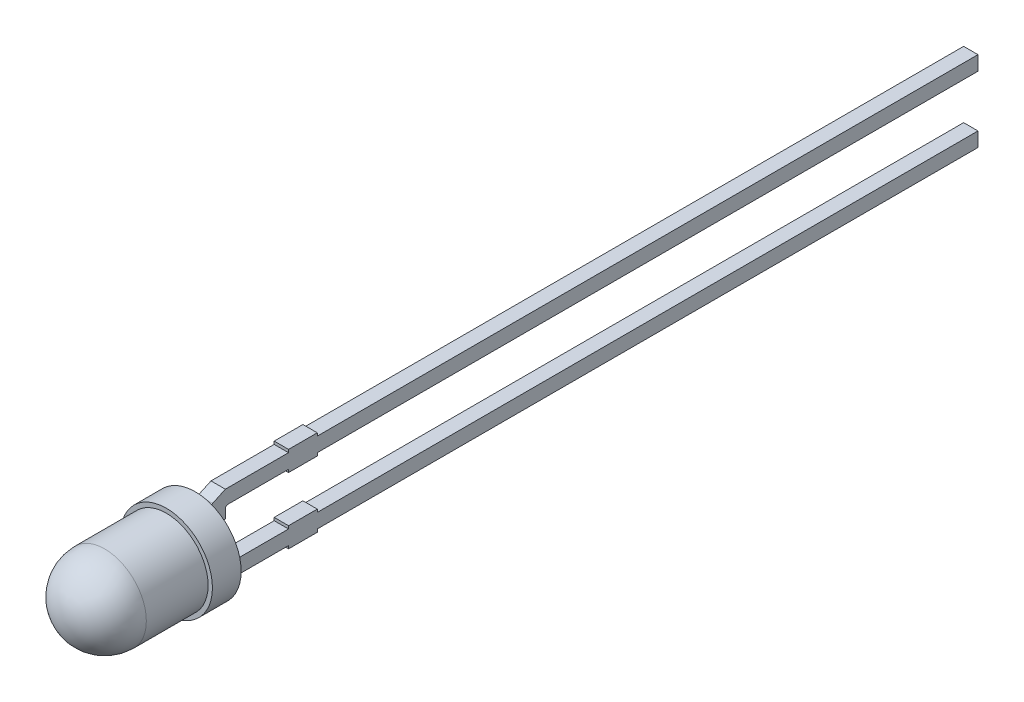
from build123d import *

# Parameters (mm, degrees)
EXTRUDE1_DEPTH = 0.25
FILLET1_R      = 0.25


with BuildPart() as part:
    # Sketch1 → Revolve1 (revolve)
    with BuildSketch(Plane(origin=(0, 0, 0), x_dir=(0, 0, -1), z_dir=(1, 0, 0))):
        with BuildLine():
            Line((0, 1.45), (2.15, 1.45))
            Line((2.15, 1.45), (2.15, 1.599999975))
            Line((2.15, 1.599999975), (3.15, 1.599999975))
            Line((3.15, 1.599999975), (3.15, 0))
            Line((3.15, 0), (-1.45, 0))
            ThreePointArc((-1.45, 0), (-1.025304833, 1.025304833), (0, 1.45))
        make_face()
    revolve(axis=Axis((0, 0, 0), (0, 0, -1)))

    # Sketch2 → Extrude1 (add, symmetric)
    with BuildSketch(Plane(origin=(0, 0, 0), x_dir=(0, 0, -1), z_dir=(1, 0, 0))):
        with BuildLine():
            Line((3.15, 1.026953873), (3.95, 1.4))
            Line((3.95, 1.4), (6.15, 1.4))
            Line((6.15, 1.4), (6.15, 1.5))
            Line((6.15, 1.5), (7.15, 1.5))
            Line((7.15, 1.5), (7.15, 1.4))
            Line((7.15, 1.4), (30.15, 1.4))
            Line((30.15, 1.4), (30.15, 0.9))
            Line((30.15, 0.9), (7.15, 0.9))
            Line((7.15, 0.9), (7.15, 0.8))
            Line((7.15, 0.8), (6.15, 0.8))
            Line((6.15, 0.8), (6.15, 0.9))
            Line((6.15, 0.9), (4.05, 0.9))
            ThreePointArc((4.05, 0.9), (3.979289322, 0.870710678), (3.95, 0.8))
            Line((3.95, 0.8), (3.95, 0.5))
            Line((3.95, 0.5), (3.15, 0.5))
            Line((3.15, 0.5), (3.15, 1.026953873))
        make_face()
        with BuildLine():
            Line((3.95, -0.8), (3.95, -0.5))
            Line((3.95, -0.5), (3.15, -0.5))
            Line((3.15, -0.5), (3.15, -1.026953873))
            Line((3.15, -1.026953873), (3.95, -1.4))
            Line((3.95, -1.4), (6.15, -1.4))
            Line((6.15, -1.4), (6.15, -1.5))
            Line((6.15, -1.5), (7.15, -1.5))
            Line((7.15, -1.5), (7.15, -1.4))
            Line((7.15, -1.4), (30.15, -1.4))
            Line((30.15, -1.4), (30.15, -0.9))
            Line((30.15, -0.9), (7.15, -0.9))
            Line((7.15, -0.9), (7.15, -0.8))
            Line((7.15, -0.8), (6.15, -0.8))
            Line((6.15, -0.8), (6.15, -0.9))
            Line((6.15, -0.9), (4.05, -0.9))
            ThreePointArc((4.05, -0.9), (3.979289322, -0.870710678), (3.95, -0.8))
        make_face()
    extrude(amount=EXTRUDE1_DEPTH, both=True)

    # Fillet1
    fillet1_edges = [part.edges().sort_by_distance(p)[0] for p in [
        (0, -0.5, -3.15),
        (0, -1.026953873, -3.15),
        (-0.25, -0.763476937, -3.15),
        (0, 0.5, -3.15),
        (-0.25, 0.763476937, -3.15),
        (0, 1.026953873, -3.15),
        (0.25, 0.763476937, -3.15),
        (0.25, -0.763476937, -3.15),
    ]]
    fillet(fillet1_edges, radius=FILLET1_R)


solid = part.part
